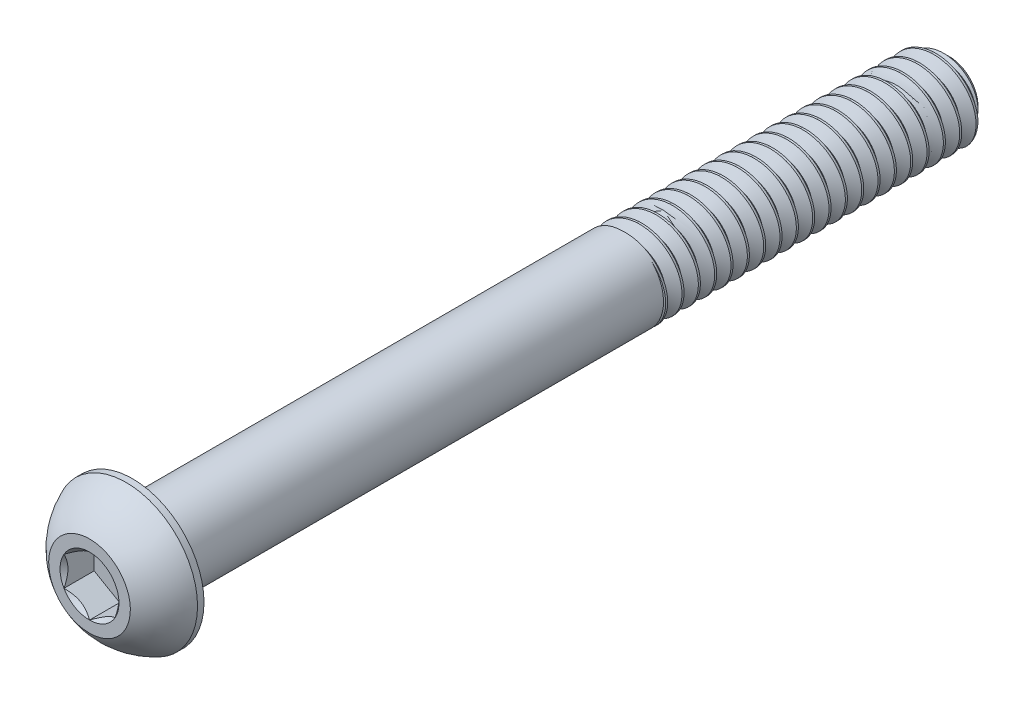
from build123d import *
from build123d.topology import SkipClean

# Parameters (mm, degrees)
SKETCH1_W           = 63.5
SKETCH1_H           = 3.175
CHAMFER1_SIZE       = 0.9525
CUT_SWEEP1_PITCH    = 1.27
CUT_EXTRUDE2_DEPTH  = 2.34696
BOSS_EXTRUDE2_START = -38.1
SKETCH9_R           = 3.175
BOSS_EXTRUDE2_DEPTH = 38.1


with BuildPart() as part:
    # Sketch1 → Revolve1 (revolve)
    with BuildSketch(Plane(origin=(0, 0, 0), x_dir=(0, 0, -1), z_dir=(1, 0, 0))):
        with Locations((35.1028, 1.5875)):
            Rectangle(SKETCH1_W, SKETCH1_H)
    revolve(axis=Axis((0, 0, -66.8528), (0, 0, 1)))

    # Chamfer1
    chamfer1_edges = [part.edges().sort_by_distance(p)[0] for p in [
        (0, -3.175, -66.8528),
    ]]
    chamfer(chamfer1_edges, length=CHAMFER1_SIZE)

    # Cut-Sweep1: arcs per turn and ends read off the stored shape
    # Cut-Sweep1: the profile of Sketch2 profile screwed along a right-hand helix through 51 turns, 8 arcs to a turn; built about Z, then put on its axis
    cut_sweep1_z = Axis((0, 0, 0), (0, 0, 1))
    cut_sweep1_corners = [(3.1753, 0, 0.000173205), (3.1753, 0, -1.111423205), (2.350110803, 0, -0.635), (2.350110803, 0, -0.47625)]
    with BuildLine(mode=Mode.PRIVATE) as cut_sweep1_profile:
        Line(cut_sweep1_corners[0], cut_sweep1_corners[1])
        Line(cut_sweep1_corners[1], cut_sweep1_corners[2])
        Line(cut_sweep1_corners[2], cut_sweep1_corners[3])
        Line(cut_sweep1_corners[3], cut_sweep1_corners[0])
    cut_sweep1_cap = Face(cut_sweep1_profile.wire())
    cut_sweep1_turn_angles = [0, 22.5, 45, 67.5, 90, 112.5, 135, 157.5, 180, 202.5, 225, 247.5, 270, 292.5, 315, 337.5, 360]
    cut_sweep1_turn_weights = [1, 0.9238795325112867, 1, 0.9238795325112867, 1, 0.9238795325112867, 1, 0.9238795325112867, 1, 0.9238795325112867, 1, 0.9238795325112867, 1, 0.9238795325112867, 1, 0.9238795325112867, 1]
    cut_sweep1_turn_rails = [Edge.make_bspline([Vector(p[0], p[1], 0).rotate(cut_sweep1_z, cut_sweep1_turn_angles[k]) / cut_sweep1_turn_weights[k] + Vector(0, 0, p[2] + CUT_SWEEP1_PITCH * cut_sweep1_turn_angles[k] / 360) for k in range(17)], [0, 0, 0, 1, 1, 2, 2, 3, 3, 4, 4, 5, 5, 6, 6, 7, 7, 8, 8, 8], 2, cut_sweep1_turn_weights) for p in cut_sweep1_corners]
    cut_sweep1_turn_sides = [Face.make_surface_from_curves(cut_sweep1_turn_rails[p[0]], cut_sweep1_turn_rails[p[1]]) for p in [(0, 1), (1, 2), (2, 3), (3, 0)]]
    cut_sweep1 = Plane(origin=(0, 0, -66.8528), x_dir=(0, 1, 0), z_dir=(0, 0, 1)) * Solid(Shell([*[p.moved(Location((0, 0, CUT_SWEEP1_PITCH * i))) for i in range(51) for p in cut_sweep1_turn_sides], cut_sweep1_cap, cut_sweep1_cap.rotate(cut_sweep1_z, 18360).moved(Location((0, 0, CUT_SWEEP1_PITCH * 18360 / 360)))]))
    add(cut_sweep1, mode=Mode.SUBTRACT)

    # Sketch7 → Revolve2 (revolve)
    with BuildSketch(Plane(origin=(0, 0, 0), x_dir=(0, 0, -1), z_dir=(1, 0, 0)), mode=Mode.PRIVATE) as revolve2_sk:
        with BuildLine():
            Line((2.84988, 5.5499), (3.3528, 5.5499))
            Line((3.3528, 5.5499), (3.3528, 0))
            Line((3.3528, 0), (0, 0))
            Line((0, 0), (0, 3.175))
            ThreePointArc((0, 3.175), (1.235921075, 4.58927271), (2.84988, 5.5499))
        make_face()
    revolve(revolve2_sk.sketch.rotate(Axis((0, 0, 0), (0, 0, -1)), 189.052465709), axis=Axis((0, 0, 0), (0, 0, -1)))

    # Sketch5 → Cut-Extrude2 (cut)
    with BuildSketch(Plane.XY):
        Polygon((1.984375, -1.14567944), (1.984375, 1.14567944), (0, 2.291358881), (-1.984375, 1.14567944), (-1.984375, -1.14567944), (0, -2.291358881), align=None)
    extrude(amount=-CUT_EXTRUDE2_DEPTH, mode=Mode.SUBTRACT)

    # Cut-Extrude3 cone 1 section (through the dimple's axis) → Cut-Extrude3 (revolve, cut)
    with BuildSketch(Plane(origin=(0, 0, 0), x_dir=(0, -1, 0), z_dir=(1, 0, 0))):
        Polygon((0, 0), (2.291358881, 0), (0, 2.291358881), align=None)
    revolve(axis=Axis((0, 0, 0), (0, 0, -1)), mode=Mode.SUBTRACT)

    # Sketch9 → Boss-Extrude2 (add)
    with SkipClean():  # the faces are left unmerged after this step: merging them gives an invalid solid
        with BuildSketch(Plane.XY.offset(-3.3528).offset(BOSS_EXTRUDE2_START)):
            with Locations(Location((0, 0, 0), (0, 0, 90))):
                Circle(SKETCH9_R)
        extrude(amount=BOSS_EXTRUDE2_DEPTH)


solid = part.part
